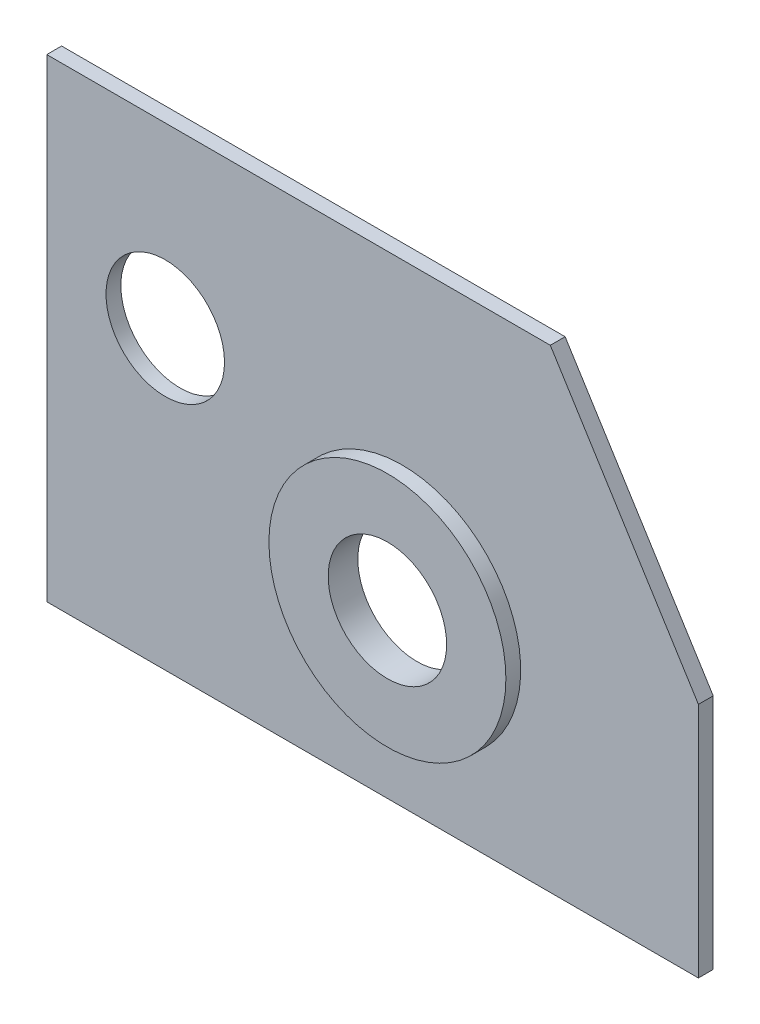
from build123d import *

# Parameters (mm, degrees)
SKETCH1_W               = 139.7
SKETCH1_H               = 101.6
BOSS_EXTRUDE1_DEPTH     = 3.175
CUT_EXTRUDE1_DEPTH      = 173.767851827
CUT_EXTRUDE1_DEPTH_BACK = 3.175
F_1_1_DIAMETER_HOLE1_D  = 25.4
SKETCH5_R               = 25.4
BOSS_EXTRUDE2_DEPTH     = 3.175
SKETCH6_R               = 12.7
CUT_EXTRUDE2_DEPTH      = 173.855351378


with BuildPart() as part:
    # Sketch1 → Boss-Extrude1 (new body)
    with BuildSketch(Plane.XY):
        with Locations((69.85, 50.8)):
            Rectangle(SKETCH1_W, SKETCH1_H)
    extrude(amount=BOSS_EXTRUDE1_DEPTH)

    # Sketch2 → Cut-Extrude1 (cut, two sides: drawn at the far end of the back side and taken through both)
    with BuildSketch(Plane.XY.offset(3.175).offset(-CUT_EXTRUDE1_DEPTH_BACK)):
        Polygon((-54.918344462, 362.189351139), (107.95, 101.6), (139.7, 50.8), (302.568344462, -209.789351139), (823.747046739, 115.947337785), (466.260357816, 687.926040062), align=None)
    extrude(amount=CUT_EXTRUDE1_DEPTH + CUT_EXTRUDE1_DEPTH_BACK, mode=Mode.SUBTRACT)

    # 1 (1) Diameter Hole1 (through all)
    with Locations(Plane.XY.offset(3.175)):
        with Locations((25.4, 63.5)):
            Hole(F_1_1_DIAMETER_HOLE1_D / 2)

    # Sketch5 → Boss-Extrude2 (add)
    with BuildSketch(Plane.XY.offset(3.175)):
        with Locations((76.2, 38.1)):
            Circle(SKETCH5_R)
    extrude(amount=BOSS_EXTRUDE2_DEPTH)

    # Sketch6 → Cut-Extrude2 (cut, through all)
    with BuildSketch(Plane.XY.offset(6.35)):
        with Locations((76.2, 38.1)):
            Circle(SKETCH6_R)
    extrude(amount=-CUT_EXTRUDE2_DEPTH, mode=Mode.SUBTRACT)


solid = part.part
